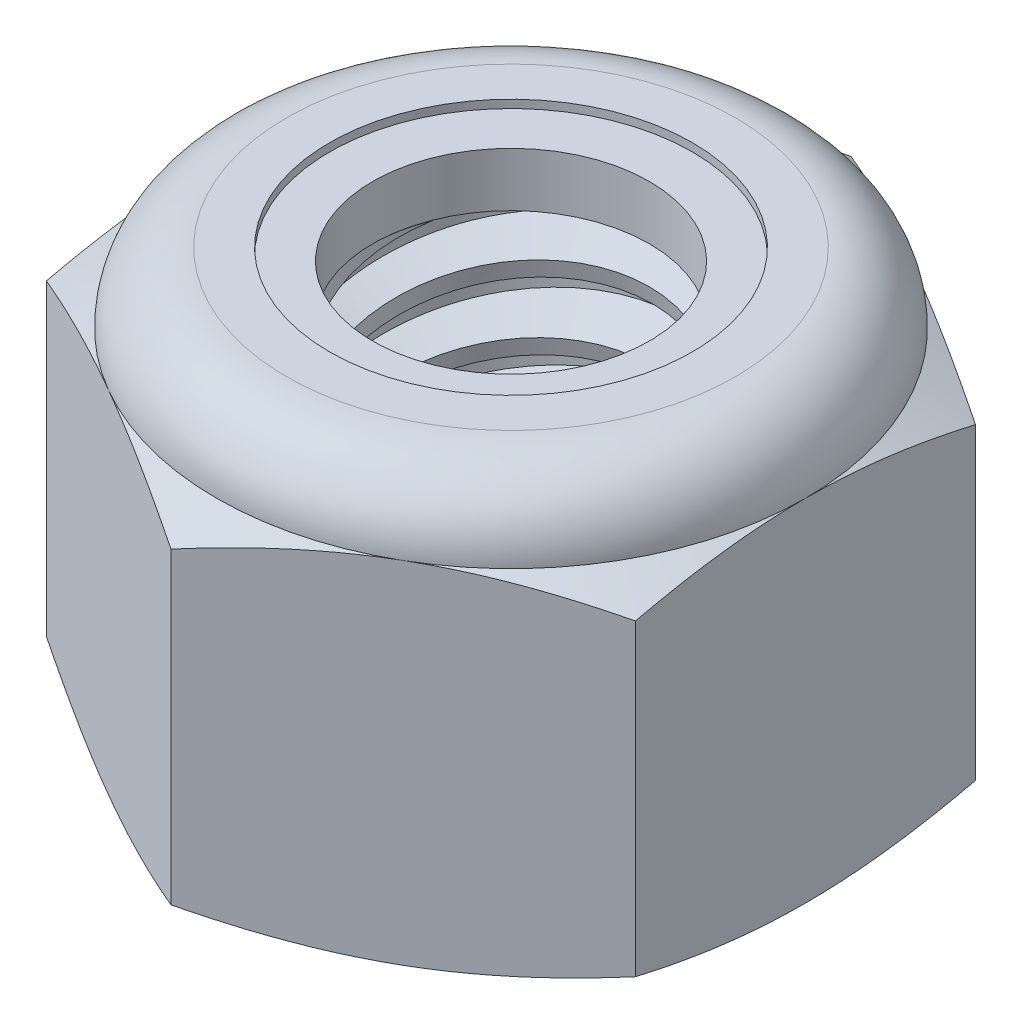
from build123d import *

# Parameters (mm, degrees)
EXTRUDE1_DEPTH       = 7.9375
SKETCH2_W            = 3.175
SKETCH2_H            = 7.9375
LPATTERN1_COUNT      = 6
LPATTERN1_PITCH      = 1.27
LPATTERN1_COUNT_DIR2 = 2
LPATTERN1_PITCH_DIR2 = 1.27


with BuildPart() as part:
    # Sketch1 → Extrude1 (new body)
    with BuildSketch(Plane(origin=(0, 0, 0), x_dir=(1, 0, 0), z_dir=(0, 1, 0))):
        Polygon((0, 6.415804866), (-5.55625, 3.207902433), (-5.55625, -3.207902433), (0, -6.415804866), (5.55625, -3.207902433), (5.55625, 3.207902433), align=None)
    extrude(amount=EXTRUDE1_DEPTH)

    # Sketch4 → Cut-Revolve2 (revolve, cut)
    with BuildSketch(Plane(origin=(0, 0, 0), x_dir=(0, 0, -1), z_dir=(1, 0, 0))):
        Polygon((0, 7.9375), (3.175, 7.9375), (2.609908356, 7.673993439), (2.609908356, 0.263506561), (3.175, 0), (0, 0), align=None)
    revolve(axis=Axis((0, 7.9375, 0), (0, 1, 0)), mode=Mode.SUBTRACT)


with BuildPart() as body_2:
    # Sketch2 → Revolve1 (revolve)
    with BuildSketch(Plane(origin=(0, 0, 0), x_dir=(0, 0, -1), z_dir=(1, 0, 0))):
        with Locations((1.5875, 3.96875)):
            Rectangle(SKETCH2_W, SKETCH2_H)
    revolve(axis=Axis((0, -3.175, 0), (0, 1, 0)))

    # Sketch3 → Cut-Revolve1 (revolve, cut)
    with BuildSketch(Plane(origin=(0, 0, 0), x_dir=(0, 0, -1), z_dir=(1, 0, 0))):
        Polygon((3.206133436, 7.781832818), (3.424067492, 6.692162542), (2.672175229, 6.946518763), (2.609908356, 7.257853128), align=None)
    cut_revolve1 = revolve(axis=Axis((0, 7.9375, 0.272704483), (0, -0.9805806756909201, -0.19611613513818424)), mode=Mode.SUBTRACT)

    # LPattern1: Cut-Revolve1 6 × 2
    with Locations(*[Vector(0, -1, 0) * (i * LPATTERN1_PITCH) + Vector(0, 1, 0) * (j * LPATTERN1_PITCH_DIR2) for i in range(LPATTERN1_COUNT) for j in range(LPATTERN1_COUNT_DIR2) if (i, j) != (0, 0)]):
        add(cut_revolve1, mode=Mode.SUBTRACT)


with BuildPart() as part_1:
    add(part.part)

    # Combine1: cut body 2
    add(body_2.part, mode=Mode.SUBTRACT)

    # Sketch5 → Cut-Revolve3 (revolve, cut)
    with BuildSketch(Plane(origin=(0, 0, 0), x_dir=(0, 0, -1), z_dir=(1, 0, 0))):
        with BuildLine():
            Line((0, 0), (5.55625, 0))
            Line((5.55625, 0), (6.415804866, 0.400817017))
            Line((6.415804866, 0.400817017), (6.415804866, 6.213766317))
            Line((6.415804866, 6.213766317), (5.55625, 6.614583333))
            ThreePointArc((5.55625, 6.614583333), (5.168776679, 7.550026679), (4.233333333, 7.9375))
            Line((4.233333333, 7.9375), (4.233333333, 9.2075))
            Line((4.233333333, 9.2075), (7.685804866, 9.2075))
            Line((7.685804866, 9.2075), (7.685804866, -1.27))
            Line((7.685804866, -1.27), (0, -1.27))
            Line((0, -1.27), (0, 0))
        make_face()
    revolve(axis=Axis((0, 0, 0), (0, 1, 0)), mode=Mode.SUBTRACT)

    # Sketch6 → Cut-Revolve4 (revolve, cut)
    with BuildSketch(Plane(origin=(0, 0, 0), x_dir=(0, 0, -1), z_dir=(1, 0, 0))):
        with BuildLine():
            Line((0, 6.614583333), (5.40385, 6.614583333))
            ThreePointArc((5.40385, 6.614583333), (5.061013606, 7.442263606), (4.233333333, 7.7851))
            Line((4.233333333, 7.7851), (3.421620845, 7.7851))
            Line((3.421620845, 7.7851), (3.421620845, 9.2075))
            Line((3.421620845, 9.2075), (0, 9.2075))
            Line((0, 9.2075), (0, 6.614583333))
        make_face()
    revolve(axis=Axis((0, 9.2075, 0), (0, 1, 0)), mode=Mode.SUBTRACT)


with BuildPart() as body_2_2:
    # Sketch7 → Revolve2 (revolve)
    with BuildSketch(Plane(origin=(0, 0, 0), x_dir=(0, 0, -1), z_dir=(1, 0, 0))):
        with BuildLine():
            Line((2.609908356, 6.690783333), (5.324993778, 6.690783333))
            ThreePointArc((5.324993778, 6.690783333), (4.979705237, 7.4148695), (4.233333333, 7.7089))
            Line((4.233333333, 7.7089), (2.609908356, 7.7089))
            Line((2.609908356, 7.7089), (2.609908356, 6.690783333))
        make_face()
    revolve(axis=Axis((0, 6.690783333, 0), (0, 1, 0)))


solid = Compound([part_1.part, body_2_2.part])
